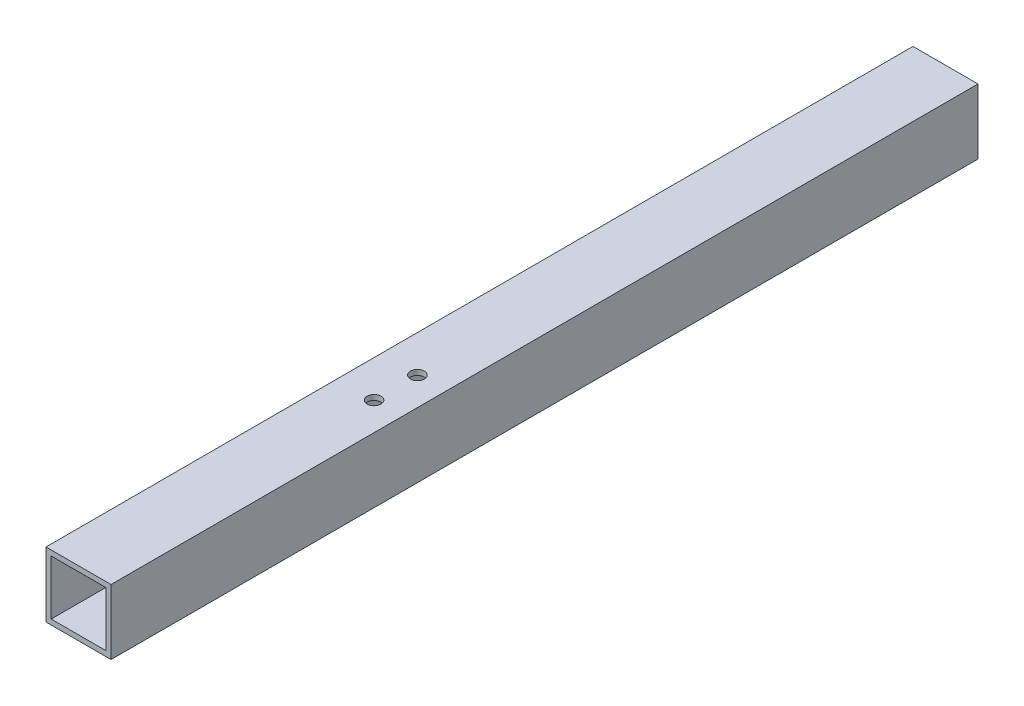
from build123d import *

# Parameters (mm, degrees)
SKETCH_1_W          = 15
SKETCH_1_H          = 15
SKETCH_1_W_2        = 12.6
SKETCH_1_H_2        = 12.6
EXTRUDE_1_DEPTH     = 200
SKETCH_2_R          = 1.6
CUT_EXTRUDE_1_DEPTH = 25


with BuildPart() as part:
    # 草图1 → 凸台-拉伸1 (new body)
    with BuildSketch(Plane.XY):
        Rectangle(SKETCH_1_W, SKETCH_1_H)
        Rectangle(SKETCH_1_W_2, SKETCH_1_H_2, mode=Mode.SUBTRACT)
    extrude(amount=EXTRUDE_1_DEPTH)

    # 草图2 → 切除-拉伸1 (cut)
    with BuildSketch(Plane.XZ.offset(7.5)):
        with Locations((1, 132.822372344)):
            Circle(SKETCH_2_R)
        with Locations((1, 122.822372344)):
            Circle(SKETCH_2_R)
    extrude(amount=-CUT_EXTRUDE_1_DEPTH, mode=Mode.SUBTRACT)


solid = part.part
